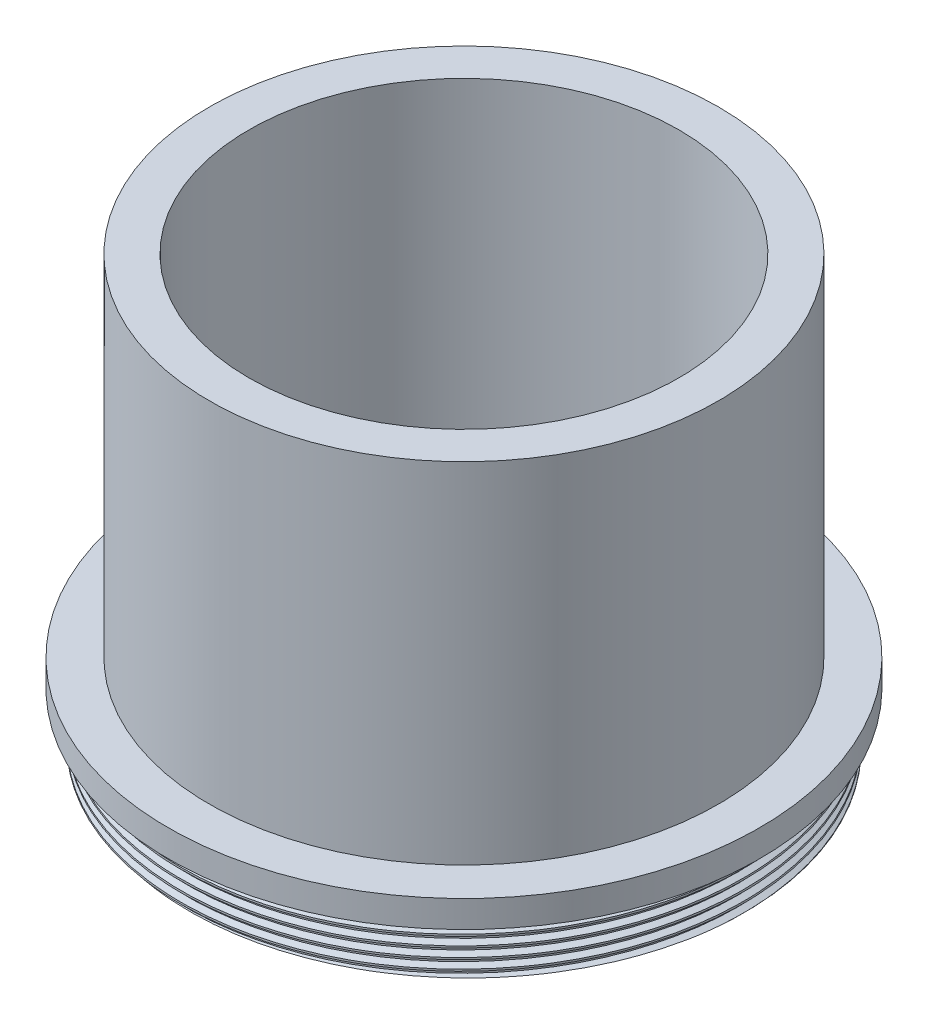
from build123d import *
from build123d.topology import SkipClean

# Parameters (mm, degrees)
THREAD2_PITCH = 0.75


with BuildPart() as part:
    # Sketch1 → Revolve1 (revolve)
    with BuildSketch(Plane.XY, mode=Mode.PRIVATE) as revolve1_sk:
        Polygon((-16, -0.0375), (-16, 31.9625), (-18.95, 31.9625), (-18.95, 5.9625), (-22, 5.9625), (-22, 3.9625), (-20.9, 3.9625), (-20.9, -0.0375), align=None)
    revolve(revolve1_sk.sketch.rotate(Axis((0, 0, 0), (0, 1, 0)), 270), axis=Axis((0, 0, 0), (0, 1, 0)))

    # Thread2: the profile of Thread Profile2 profile screwed along a right-hand helix of 56 turns, 6 arcs to a turn; built about Z, then put on its axis
    with SkipClean():  # the faces are left unmerged after this step: merging them gives an invalid solid
        thread2_z = Axis((0, 0, 0), (0, 0, 1))
        thread2_corners = [(20.9003, 0, -0.000173205), (20.9003, 0, 0.612673203), (20.521113887, 0, 0.393749999), (20.521113887, 0, 0.218749999)]
        with BuildLine(mode=Mode.PRIVATE) as thread2_profile:
            Line(thread2_corners[0], thread2_corners[1])
            Line(thread2_corners[1], thread2_corners[2])
            Line(thread2_corners[2], thread2_corners[3])
            Line(thread2_corners[3], thread2_corners[0])
        thread2_cap = Face(thread2_profile.wire())
        thread2_turn_angles = [0, 30, 60, 90, 120, 150, 180, 210, 240, 270, 300, 330, 360, 390, 420, 450, 480, 510, 540, 570, 600, 630, 660, 690, 720]
        thread2_turn_weights = [1, 0.8660254037844387, 1, 0.8660254037844387, 1, 0.8660254037844387, 1, 0.8660254037844387, 1, 0.8660254037844387, 1, 0.8660254037844387, 1, 0.8660254037844387, 1, 0.8660254037844387, 1, 0.8660254037844387, 1, 0.8660254037844387, 1, 0.8660254037844387, 1, 0.8660254037844387, 1]
        thread2_turn_rails = [Edge.make_bspline([Vector(p[0], p[1], 0).rotate(thread2_z, thread2_turn_angles[k]) / thread2_turn_weights[k] + Vector(0, 0, p[2] + THREAD2_PITCH * thread2_turn_angles[k] / 360) for k in range(25)], [0, 0, 0, 1, 1, 2, 2, 3, 3, 4, 4, 5, 5, 6, 6, 7, 7, 8, 8, 9, 9, 10, 10, 11, 11, 12, 12, 12], 2, thread2_turn_weights) for p in thread2_corners]
        thread2_turn_sides = [Face.make_surface_from_curves(thread2_turn_rails[p[0]], thread2_turn_rails[p[1]]) for p in [(0, 1), (1, 2), (2, 3), (3, 0)]]
        thread2 = Plane(origin=(0, 3.9625, 0), x_dir=(-1, 0, 0), z_dir=(0, -1, 0)) * Solid(Shell([*[p.moved(Location((0, 0, 2 * THREAD2_PITCH * i))) for i in range(28) for p in thread2_turn_sides], thread2_cap, thread2_cap.rotate(thread2_z, 20160).moved(Location((0, 0, THREAD2_PITCH * 20160 / 360)))]))
        add(thread2, mode=Mode.SUBTRACT)


solid = part.part
